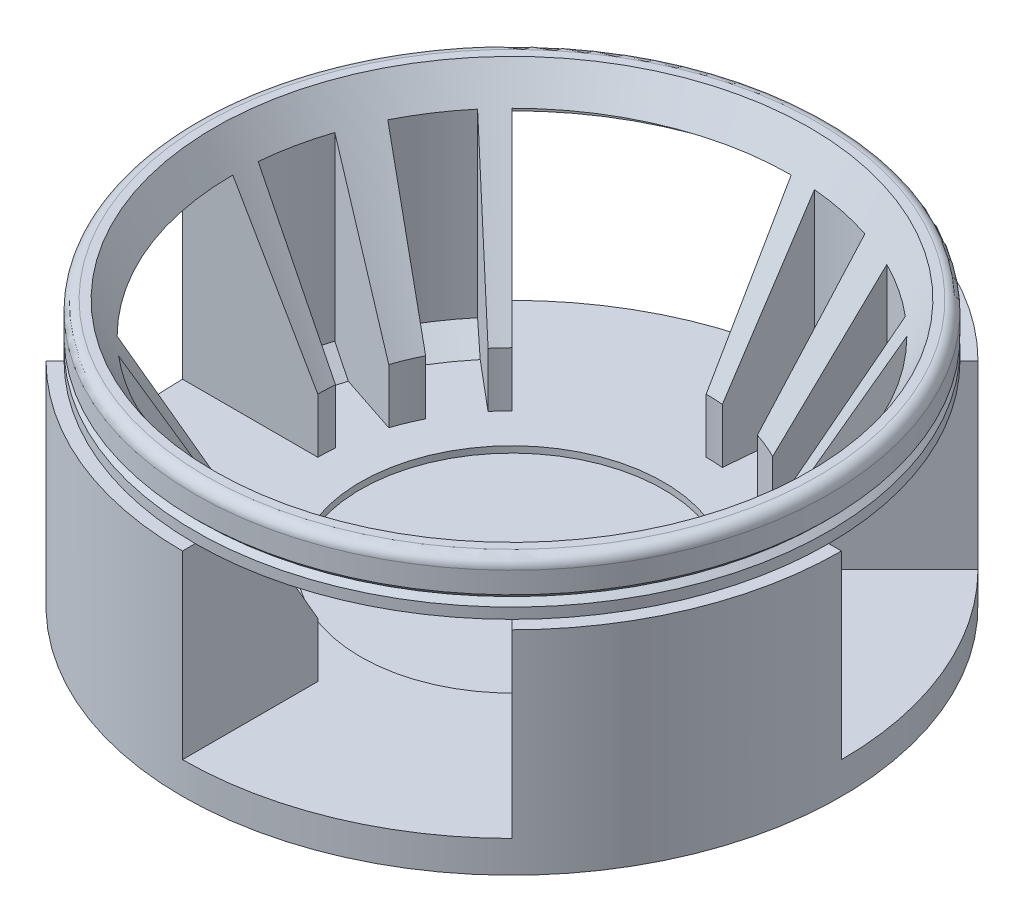
from build123d import *
from OCP.BRepFilletAPI import BRepFilletAPI_MakeChamfer
from build123d.topology import SkipClean

# Parameters (mm, degrees)
SKETCH_1_R          = 31
EXTRUDE_1_DEPTH     = 3
EXTRUDE_2_DEPTH     = 22
SKETCH_3_R          = 14.25
CUT_EXTRUDE_1_DEPTH = 0.6
CUT_EXTRUDE_START   = -5
SKETCH_4_R          = 31
SKETCH_4_R_2        = 29.8
CUT_EXTRUDE_2_DEPTH = 5
FILLET_1_R          = 1
CHAMFER_1_SIZE      = 22
CHAMFER_1_SIZE_2    = 12.701705922
CUT_EXTRUDE_3_DEPTH = 22
SKETCH_7_R          = 18.267949192
CUT_EXTRUDE_4_DEPTH = 22
CHAMFER_2_SIZE      = 2


with BuildPart() as part:
    # 草图1 → 凸台-拉伸1 (new body)
    with BuildSketch(Plane(origin=(0, 0, 0), x_dir=(1, 0, 0), z_dir=(0, 1, 0))):
        with Locations(Location((0, 0, 0), (0, 0, 270))):
            Circle(SKETCH_1_R)
    extrude(amount=EXTRUDE_1_DEPTH)

    # 草图2 → 凸台-拉伸2 (add)
    with SkipClean():  # the faces are left unmerged after this step: merging them gives an invalid solid
        with BuildSketch(Plane(origin=(0, 3, 0), x_dir=(1, 0, 0), z_dir=(0, 1, 0))):
            with BuildLine():
                Line((0, 31), (0, 28))
                ThreePointArc((0, 28), (10.715136106, 25.86862691), (19.798989873, 19.798989873))
                Line((19.798989873, 19.798989873), (21.920310217, 21.920310217))
                ThreePointArc((21.920310217, 21.920310217), (11.863186403, 28.640265508), (0, 31))
            make_face()
            with BuildLine():
                ThreePointArc((-28, 0), (-25.86862691, 10.715136106), (-19.798989873, 19.798989873))
                Line((-19.798989873, 19.798989873), (-21.920310217, 21.920310217))
                ThreePointArc((-21.920310217, 21.920310217), (-28.640265508, 11.863186403), (-31, 0))
                Line((-31, 0), (-28, 0))
            make_face()
            with BuildLine():
                ThreePointArc((0, -28), (-10.715136106, -25.86862691), (-19.798989873, -19.798989873))
                Line((-19.798989873, -19.798989873), (-21.920310217, -21.920310217))
                ThreePointArc((-21.920310217, -21.920310217), (-11.863186403, -28.640265508), (0, -31))
                Line((0, -31), (0, -28))
            make_face()
            with BuildLine():
                Line((31, 0), (28, 0))
                ThreePointArc((28, 0), (25.86862691, -10.715136106), (19.798989873, -19.798989873))
                Line((19.798989873, -19.798989873), (21.920310217, -21.920310217))
                ThreePointArc((21.920310217, -21.920310217), (28.640265508, -11.863186403), (31, 0))
            make_face()
        extrude(amount=EXTRUDE_2_DEPTH)

    # 草图3 → 切除-拉伸1 (cut)
    with SkipClean():  # the faces are left unmerged after this step: merging them gives an invalid solid
        with BuildSketch(Plane(origin=(0, 3, 0), x_dir=(1, 0, 0), z_dir=(0, 1, 0))):
            with Locations(Location((0, 0, 0), (0, 0, 270))):
                Circle(SKETCH_3_R)
        extrude(amount=-CUT_EXTRUDE_1_DEPTH, mode=Mode.SUBTRACT)

    # 草图4 → 切除-拉伸2 (cut)
    with SkipClean():  # the faces are left unmerged after this step: merging them gives an invalid solid
        with BuildSketch(Plane(origin=(0, 25, 0), x_dir=(1, 0, 0), z_dir=(0, 1, 0)).offset(CUT_EXTRUDE_START)):
            with Locations(Location((0, 0, 0), (0, 0, 270))):
                Circle(SKETCH_4_R)
            Circle(SKETCH_4_R_2, mode=Mode.SUBTRACT)
        extrude(amount=CUT_EXTRUDE_2_DEPTH, mode=Mode.SUBTRACT)

    # 圆角1
    fillet_1_edges = [part.edges().sort_by_distance(p)[0] for p in [
        (27.531610069, 25, 11.403966284),
        (11.403966284, 25, -27.531610069),
        (-27.531610069, 25, -11.403966284),
        (-11.403966284, 25, 27.531610069),
    ]]
    fillet(fillet_1_edges, radius=FILLET_1_R)

    # 倒角1
    chamfer_1_edges_1 = [part.edges().sort_by_distance(p)[0] for p in [
        (-10.715136106, 3, 25.86862691),
    ]]
    chamfer_1_side_1 = [part.faces().sort_by_distance(p)[0] for p in [
        (-10.715136106, 3.254034118, 25.86862691),
    ]]
    chamfer_1_edges_2 = [part.edges().sort_by_distance(p)[0] for p in [
        (25.86862691, 3, 10.715136106),
    ]]
    chamfer_1_side_2 = [part.faces().sort_by_distance(p)[0] for p in [
        (25.633929988, 3, 10.617921458),
    ]]
    chamfer_1_edges_3 = [part.edges().sort_by_distance(p)[0] for p in [
        (10.715136106, 3, -25.86862691),
    ]]
    chamfer_1_side_3 = [part.faces().sort_by_distance(p)[0] for p in [
        (10.617921458, 3, -25.633929988),
    ]]
    chamfer_1_edges_4 = [part.edges().sort_by_distance(p)[0] for p in [
        (-25.86862691, 3, -10.715136106),
    ]]
    chamfer_1_side_4 = [part.faces().sort_by_distance(p)[0] for p in [
        (-25.633929988, 3, -10.617921458),
    ]]
    chamfer_1 = BRepFilletAPI_MakeChamfer(part.part.solid().wrapped)
    for e in chamfer_1_edges_1:
        chamfer_1.Add(CHAMFER_1_SIZE - 0.0001, CHAMFER_1_SIZE_2 - 0.0001, e.wrapped, chamfer_1_side_1[0].wrapped)
    for e in chamfer_1_edges_2:
        chamfer_1.Add(CHAMFER_1_SIZE_2 - 0.0001, CHAMFER_1_SIZE - 0.0001, e.wrapped, chamfer_1_side_2[0].wrapped)
    for e in chamfer_1_edges_3:
        chamfer_1.Add(CHAMFER_1_SIZE_2 - 0.0001, CHAMFER_1_SIZE - 0.0001, e.wrapped, chamfer_1_side_3[0].wrapped)
    for e in chamfer_1_edges_4:
        chamfer_1.Add(CHAMFER_1_SIZE_2 - 0.0001, CHAMFER_1_SIZE - 0.0001, e.wrapped, chamfer_1_side_4[0].wrapped)
    add(Compound.cast(chamfer_1.Shape()), mode=Mode.REPLACE)  # a hair under: the kernel refuses the full size

    # 草图5 → 旋转1 (revolve)
    with SkipClean():  # the faces are left unmerged after this step: merging them gives an invalid solid
        with BuildSketch(Plane(origin=(0, 0, 0), x_dir=(0.7071067811865462, 0, -0.7071067811865488), z_dir=(0.7071067811865488, 0, 0.7071067811865462)), mode=Mode.PRIVATE) as revolve_1_sk:
            with BuildLine():
                Line((26.267949192, 22), (28, 25))
                Line((28, 25), (28.8, 25))
                ThreePointArc((28.8, 25), (29.507106781, 24.707106781), (29.8, 24))
                Line((29.8, 24), (29.8, 20))
                Line((29.8, 20), (28.8, 20))
                Line((28.8, 20), (28.8, 21.2))
                Line((28.8, 21.2), (28.8, 22.471926391))
                ThreePointArc((28.8, 22.471926391), (28.419938572, 22.967232087), (27.843142872, 22.728315485))
                Line((27.843142872, 22.728315485), (27.422649731, 22))
                Line((27.422649731, 22), (26.267949192, 22))
            make_face()
        revolve(revolve_1_sk.sketch.rotate(Axis((0, 0, 0), (0, 1, 0)), 225), axis=Axis((0, 0, 0), (0, 1, 0)))

    # 草图6 → 切除-拉伸3 (cut)
    with SkipClean():  # the faces are left unmerged after this step: merging them gives an invalid solid
        with BuildSketch(Plane(origin=(0, 25, 0), x_dir=(1, 0, 0), z_dir=(0, 1, 0))):
            with BuildLine():
                Line((2.289402622, 26.167991715), (1.333334183, 15.24007945))
                ThreePointArc((1.333334183, 15.24007945), (3.093583453, 14.982240924), (4.811997335, 14.521793393))
                Line((4.811997335, 14.521793393), (8.262444223, 24.934658013))
                ThreePointArc((8.262444223, 24.934658013), (5.311840168, 25.725269849), (2.289402622, 26.167991715))
            make_face()
            with BuildLine():
                Line((11.789035429, 23.473896107), (6.865862636, 13.67105453))
                ThreePointArc((6.865862636, 13.67105453), (8.406550317, 12.781537993), (9.833553883, 11.719173168))
                Line((9.833553883, 11.719173168), (16.884712273, 20.122416511))
                ThreePointArc((16.884712273, 20.122416511), (14.434474555, 21.946550961), (11.789035429, 23.473896107))
            make_face()
            with BuildLine():
                Line((26.167991715, -2.289402622), (15.24007945, -1.333334183))
                ThreePointArc((15.24007945, -1.333334183), (15.236219542, -1.376740994), (15.232236002, -1.420136634))
                ThreePointArc((15.232236002, -1.420136634), (14.973367893, -3.136248655), (14.521793393, -4.811997335))
                Line((14.521793393, -4.811997335), (24.934658013, -8.262444223))
                ThreePointArc((24.934658013, -8.262444223), (25.725269849, -5.311840168), (26.167991715, -2.289402622))
            make_face()
            with BuildLine():
                ThreePointArc((20.122416511, -16.884712273), (21.946550961, -14.434474555), (23.473896107, -11.789035429))
                Line((23.473896107, -11.789035429), (13.67105453, -6.865862636))
                ThreePointArc((13.67105453, -6.865862636), (13.568862199, -7.06567621), (13.46374963, -7.263969136))
                ThreePointArc((13.46374963, -7.263969136), (12.656839716, -8.593149021), (11.719173168, -9.833553883))
                Line((11.719173168, -9.833553883), (20.122416511, -16.884712273))
            make_face()
            with BuildLine():
                Line((-4.811997335, -14.521793393), (-8.262444223, -24.934658013))
                ThreePointArc((-8.262444223, -24.934658013), (-5.311840168, -25.725269849), (-2.289402622, -26.167991715))
                Line((-2.289402622, -26.167991715), (-1.333334183, -15.24007945))
                ThreePointArc((-1.333334183, -15.24007945), (-1.872450055, -15.183271468), (-2.409214758, -15.107398384))
                ThreePointArc((-2.409214758, -15.107398384), (-3.622459016, -14.86322954), (-4.811997335, -14.521793393))
            make_face()
            with BuildLine():
                ThreePointArc((-8.03901839, -13.015835933), (-8.959773629, -12.400010411), (-9.833553883, -11.719173168))
                Line((-9.833553883, -11.719173168), (-16.884712273, -20.122416511))
                ThreePointArc((-16.884712273, -20.122416511), (-14.434474555, -21.946550961), (-11.789035429, -23.473896107))
                Line((-11.789035429, -23.473896107), (-6.865862636, -13.67105453))
                ThreePointArc((-6.865862636, -13.67105453), (-7.45963789, -13.356331991), (-8.03901839, -13.015835933))
            make_face()
            with BuildLine():
                ThreePointArc((-15.24007945, 1.333334183), (-14.982240924, 3.093583453), (-14.521793393, 4.811997335))
                Line((-14.521793393, 4.811997335), (-24.934658013, 8.262444223))
                ThreePointArc((-24.934658013, 8.262444223), (-25.619900687, 5.798779489), (-26.062342723, 3.280159533))
                ThreePointArc((-26.062342723, 3.280159533), (-26.119865212, 2.785282046), (-26.167991715, 2.289402622))
                Line((-26.167991715, 2.289402622), (-15.24007945, 1.333334183))
            make_face()
            with BuildLine():
                ThreePointArc((-13.67105453, 6.865862636), (-12.781537993, 8.406550317), (-11.719173168, 9.833553883))
                Line((-11.719173168, 9.833553883), (-20.122416511, 16.884712273))
                ThreePointArc((-20.122416511, 16.884712273), (-21.697809703, 14.805749182), (-23.059246756, 12.580790668))
                ThreePointArc((-23.059246756, 12.580790668), (-23.26993909, 12.186676721), (-23.473896107, 11.789035429))
                Line((-23.473896107, 11.789035429), (-13.67105453, 6.865862636))
            make_face()
        extrude(amount=-CUT_EXTRUDE_3_DEPTH, mode=Mode.SUBTRACT)

    # 草图7 → 切除-拉伸4 (cut)
    with SkipClean():  # the faces are left unmerged after this step: merging them gives an invalid solid
        with BuildSketch(Plane(origin=(0, 25, 0), x_dir=(1, 0, 0), z_dir=(0, 1, 0))):
            Circle(SKETCH_7_R)
        extrude(amount=-CUT_EXTRUDE_4_DEPTH, mode=Mode.SUBTRACT)

    # 草图9 → 切除-旋转1 (revolve, cut)
    with SkipClean():  # the faces are left unmerged after this step: merging them gives an invalid solid
        with BuildSketch(Plane.XY, mode=Mode.PRIVATE) as cut_revolve_1_sk:
            Polygon((29.8, 22), (29.3, 21.5), (29.8, 21), align=None)
        revolve(cut_revolve_1_sk.sketch.rotate(Axis((0, 0, 0), (0, 1, 0)), 90), axis=Axis((0, 0, 0), (0, 1, 0)), mode=Mode.SUBTRACT)

    # 倒角2
    chamfer_2_edges = [part.edges().sort_by_distance(p)[0] for p in [
        (-5.311840168, 3, 25.725269849),
        (21.946550961, 3, 14.434474555),
        (25.725269849, 3, 5.311840168),
        (14.434474555, 3, -21.946550961),
        (-21.946550961, 3, -14.434474555),
        (-25.725269849, 3, -5.311840168),
        (-14.434474555, 3, 21.946550961),
        (5.311840168, 3, -25.725269849),
    ]]
    chamfer(chamfer_2_edges, length=CHAMFER_2_SIZE)


solid = part.part
